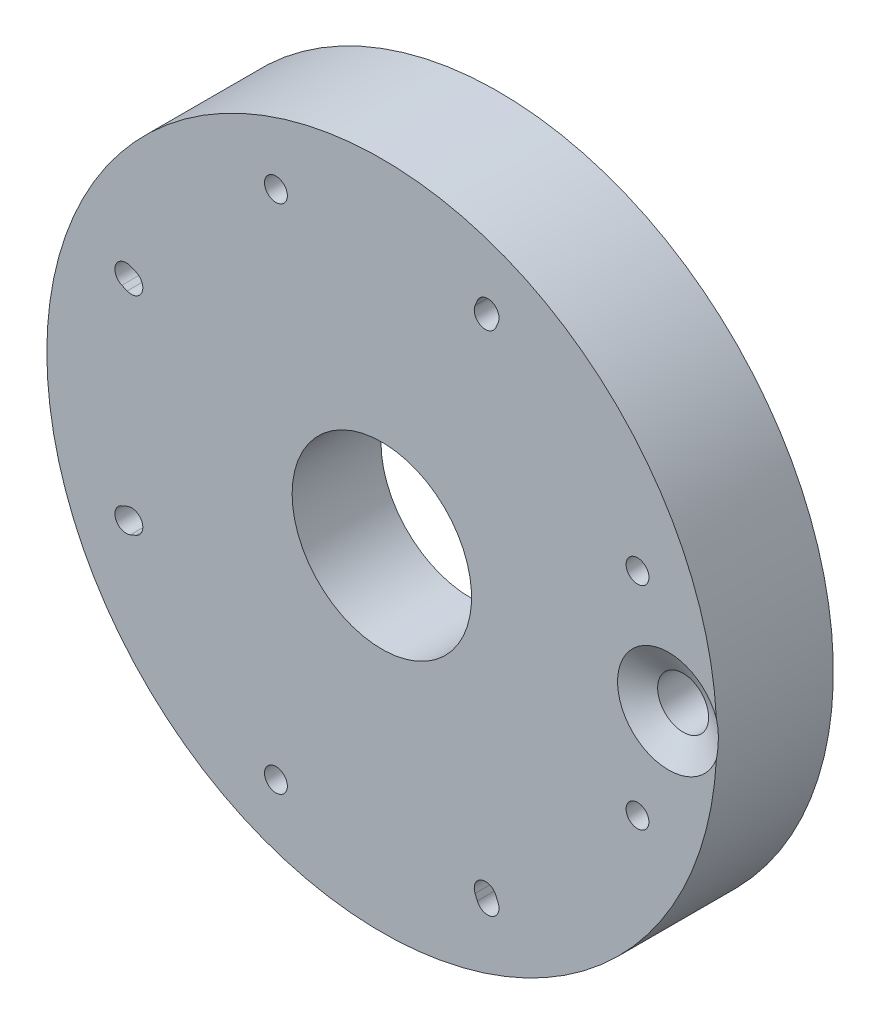
from build123d import *

# Parameters (mm, degrees)
CUT_EXTRUDE1_START               = 4.2164
SKETCH18_R                       = 57.15
CUT_EXTRUDE1_DEPTH               = 4.2164
F_10_CLEARANCE_HOLE1_D           = 4.9784
CIRPATTERN1_COUNT                = 8
CLEARANCING_START                = -4.2164
SKETCH32_R                       = 73.025
CLEARANCING_DEPTH                = 4.2164
F_10_START                       = 4.2164
F_10_0_1935_DIAMETER_SLOT1_DEPTH = 25.4
CIRPATTERN2_COUNT                = 8


# Read off the part's stored shape, not the designer's step: #10 (0.1935) Diameter Slot1
with BuildPart() as part:
    # Sketch25 → Revolve1 (revolve)
    with BuildSketch(Plane(origin=(0, 0, 0), x_dir=(1, 0, 0), z_dir=(0, 1, 0))):
        Polygon((-19.558, -29.6164), (-19.558, -10.24382), (-39.2684, -10.24382), (-39.2684, 0), (-57.15, 0), (-57.15, -4.2164), (-73.025, -4.2164), (-73.025, -29.6164), align=None)
    revolve(axis=Axis((0, 0, -8.4836), (0, 0, 1)))

    # Sketch18 → Cut-Extrude1 (cut)
    with BuildSketch(Plane.XY.offset(CUT_EXTRUDE1_START)):
        Circle(SKETCH18_R)
        with BuildLine():
            add(Edge.make_bspline(
                [(41.089237213, 0), (41.091962531, -0.086157587), (41.097413749, -0.258491166), (41.10355964, -0.517077072), (41.10820678, -0.775748178), (41.11421023, -1.293415642), (41.109015311, -2.589274196), (41.017814103, -4.490313926), (40.7831208, -6.729807087), (40.462314107, -8.787506492), (40.037808727, -10.829994254), (39.510298345, -12.852043551), (38.880746853, -14.848458078), (38.15038378, -16.814086746), (37.320701547, -18.743836999), (36.393451781, -20.63268838), (35.370641466, -22.475705706), (34.254528452, -24.268052099), (33.047616433, -26.005001751), (31.752649319, -27.681952446), (30.372605018, -29.294437787), (28.910688618, -30.83813911), (27.370324987, -32.308897058), (25.755150794, -33.702722776), (24.069005972, -35.015808715), (22.315924639, -36.244539), (20.500125495, -37.385499343), (18.62600172, -38.435486481), (16.698110388, -39.3915171), (14.721161433, -40.250836227), (12.700006186, -41.010925075), (10.639625512, -41.669508306), (8.545117571, -42.224560694), (6.421685244, -42.674313186), (4.274623243, -43.017258312), (2.109304944, -43.252154961), (-0.068831028, -43.378032487), (-2.254294428, -43.394194133), (-4.441557201, -43.300219785), (-6.625067428, -43.095968006), (-8.799263397, -42.781577389), (-10.958587737, -42.35746718), (-13.097501591, -41.8243372), (-15.210498799, -41.183167044), (-17.292120038, -40.435214565), (-19.336966901, -39.582013644), (-21.339715858, -38.62537124), (-23.295132091, -37.567363743), (-25.198083132, -36.410332623), (-27.043552306, -35.156879378), (-28.826651909, -33.809859817), (-30.542636113, -32.372377659), (-32.186913551, -30.847777489), (-33.75505955, -29.239637062), (-35.242827981, -27.551758997), (-36.6461627, -25.788161864), (-37.961208531, -23.953070684), (-39.184321792, -22.050906876), (-40.312080298, -20.086277666), (-41.34129285, -18.063964982), (-42.269008156, -15.988913871), (-43.092523175, -13.866220454), (-43.809390856, -11.701119456), (-44.417427247, -9.498971339), (-44.914717965, -7.265249075), (-45.299623986, -5.005524575), (-45.570786769, -2.725454833), (-45.727132667, -0.430767795), (-45.767876634, 1.872751999), (-45.692525205, 4.179277959), (-45.500878745, 6.482956161), (-45.193032951, 8.777920163), (-44.76937961, 11.058305925), (-44.2306066, 13.318266753), (-43.577697135, 15.551988265), (-42.811928261, 17.753703317), (-41.934868588, 19.917706858), (-40.948375273, 22.038370685), (-39.854590259, 24.110158043), (-38.655935769, 26.127638043), (-37.35510908, 28.085499861), (-35.95507656, 29.978566677), (-34.45906702, 31.801809315), (-32.870564351, 33.550359561), (-31.193299507, 35.2195231), (-29.431241811, 36.804792072), (-27.58858964, 38.301857174), (-25.669760482, 39.706619311), (-23.67938041, 41.015200739), (-21.62227298, 42.22395569), (-19.503447594, 43.329480427), (-17.328087349, 44.32862273), (-15.101536401, 45.218490759), (-12.829286876, 45.996461288), (-10.51696536, 46.660187279), (-8.170319005, 47.207604779), (-5.795201275, 47.63693911), (-3.397557376, 47.946710349), (-0.983409407, 48.13573807), (1.441158736, 48.203145338), (3.870016668, 48.148361942), (6.297002983, 47.971126851), (8.715940862, 47.671489899), (11.120653763, 47.249812672), (13.504981164, 46.706768607), (15.862794321, 46.043342297), (18.188011992, 45.260827993), (20.47461609, 44.360827321), (22.71666723, 43.345246195), (24.908320125, 42.216290953), (27.043838787, 40.976463712), (29.117611505, 39.628556947), (31.12416555, 38.175647316), (33.058181574, 36.621088743), (34.914507669, 34.968504765), (36.688173034, 33.221780166), (38.374401232, 31.385051924), (39.968622994, 29.462699478), (41.466488529, 27.459334348), (42.863879321, 25.37978913), (44.156919368, 23.229105887), (45.341985843, 21.012523976), (46.415719137, 18.735467323), (47.152873419, 16.943563677), (47.537044371, 15.914838228), (47.625380995, 15.672606956)],
                knots=[0, 0, 0, 0, 0.000898736, 0.001797664, 0.002696784, 0.003596095, 0.007195255, 0.016206602, 0.023429565, 0.030664921, 0.03791271, 0.04517297, 0.052445735, 0.059731037, 0.067028905, 0.074339368, 0.081662453, 0.088998186, 0.096346593, 0.103707696, 0.111081519, 0.118468084, 0.125867414, 0.13327953, 0.140704451, 0.148142199, 0.155592793, 0.163056252, 0.170532595, 0.178021841, 0.185524007, 0.193039111, 0.200567171, 0.208108204, 0.215662226, 0.223229255, 0.230809306, 0.238402396, 0.24600854, 0.253627754, 0.261260054, 0.268905454, 0.27656397, 0.284235617, 0.291920409, 0.29961836, 0.307329485, 0.315053798, 0.322791313, 0.330542044, 0.338306004, 0.346083208, 0.353873668, 0.361677398, 0.369494411, 0.37732472, 0.385168337, 0.393025277, 0.400895551, 0.408779172, 0.416676152, 0.424586504, 0.432510241, 0.440447374, 0.448397915, 0.456361877, 0.464339271, 0.472330109, 0.480334403, 0.488352164, 0.496383405, 0.504428136, 0.512486369, 0.520558115, 0.528643386, 0.536742193, 0.544854546, 0.552980457, 0.561119937, 0.569272997, 0.577439648, 0.585619899, 0.593813763, 0.60202125, 0.61024237, 0.618477134, 0.626725552, 0.634987634, 0.643263392, 0.651552835, 0.659855974, 0.668172818, 0.676503379, 0.684847665, 0.693205688, 0.701577457, 0.709962981, 0.718362272, 0.726775338, 0.73520219, 0.743642837, 0.752097289, 0.760565555, 0.769047646, 0.777543571, 0.786053339, 0.79457696, 0.803114443, 0.811665798, 0.820231034, 0.828810161, 0.837403187, 0.846010122, 0.854630975, 0.863265756, 0.871914473, 0.880577136, 0.889253753, 0.897944334, 0.906648887, 0.915367423, 0.924099948, 0.932846474, 0.941607007, 0.944295232, 0.944295232, 0.944295232, 0.944295232], degree=3))
            ThreePointArc((47.625380995, 15.672606956), (47.687720846, 10.629001226), (44.585991464, 6.651424093))
            ThreePointArc((44.585991464, 6.651424093), (41.960682048, 3.786728615), (41.089237213, 0))
        make_face(mode=Mode.SUBTRACT)
    extrude(amount=-CUT_EXTRUDE1_DEPTH, mode=Mode.SUBTRACT)

    # Sketch20 one side → Turbine Shaft Hole (revolve, cut)
    with BuildSketch(Plane(origin=(0, 0, 0), x_dir=(1, 0, 0), z_dir=(0, 1, 0)), mode=Mode.PRIVATE) as turbine_shaft_hole_sk:
        Polygon((56.94375, -26.4414), (51.3875, -29.6164), (62.5, -29.6164), (62.5, -4.2164), (56.94375, -4.2164), align=None)
    revolve(turbine_shaft_hole_sk.sketch.rotate(Axis((62.5, 0, 29.6164), (0, 0, -1)), 180), axis=Axis((62.5, 0, 29.6164), (0, 0, -1)), mode=Mode.SUBTRACT)

    # #10 Clearance Hole1 (through all)
    with Locations(Plane(origin=(55.733032799, -23.085378057, 29.6164), x_dir=(1, 0, 0), z_dir=(0, 0, 1))):
        with Locations((0, 0)):
            f_10_clearance_hole1 = Hole(F_10_CLEARANCE_HOLE1_D / 2)

    # CirPattern1: #10 Clearance Hole1 ×8 about axis, 4 skipped
    cirpattern1_axis = Axis((0, 0, 0), (0, 0, 1))
    add([f_10_clearance_hole1.rotate(cirpattern1_axis, i * 360 / CIRPATTERN1_COUNT) for i in range(1, CIRPATTERN1_COUNT) if i not in (2, 4, 5, 7)], mode=Mode.SUBTRACT)

    # Sketch32 → Clearancing (cut)
    with BuildSketch(Plane(origin=(0, 0, 0), x_dir=(-1, 0, 0), z_dir=(0, 0, -1)).offset(CLEARANCING_START)):
        Circle(SKETCH32_R)
        with BuildLine():
            ThreePointArc((-47.506067229, 15.629095748), (-47.567368082, 10.669550114), (-44.51733419, 6.758265932))
            ThreePointArc((-44.51733419, 6.758265932), (-41.848269617, 3.845825531), (-40.962300701, -0.004015228))
            add(Edge.make_bspline(
                [(-40.962300701, -0.004015228), (-40.984829754, -0.716243545), (-40.991482345, -1.426292399), (-40.965808515, -2.841039211), (-40.934791994, -3.545916987), (-40.788046598, -5.65317915), (-40.449416827, -8.44323574), (-39.826992242, -11.194334019), (-39.251228801, -13.242702158), (-39.04041264, -13.924921757), (-38.586043887, -15.271416492), (-38.342460818, -15.936244836), (-37.044241995, -19.219159068), (-35.751111298, -21.714802599), (-33.817948717, -24.671739224), (-33.415325439, -25.254916955), (-32.577512865, -26.404553153), (-32.142989691, -26.969901223), (-30.805310798, -28.622109954), (-29.863742521, -29.67138319), (-27.88370287, -31.668321975), (-26.84522274, -32.615978344), (-25.214580249, -33.961000268), (-24.658855428, -34.396572383), (-23.52273746, -35.241850655), (-22.941371199, -35.652200602), (-19.982337143, -37.630798215), (-17.495723306, -38.952149767), (-13.594391809, -40.558687212), (-12.265158452, -41.031133778), (-10.227142901, -41.643055288), (-9.538560062, -41.831284287), (-8.159344959, -42.171675018), (-7.468051402, -42.324142065), (-4.003321953, -42.999606071), (-1.205332292, -43.264420661), (2.324696242, -43.253266134), (3.032343885, -43.233770306), (4.450976737, -43.159684207), (5.16260658, -43.104918353), (7.279359647, -42.889714494), (8.673993393, -42.678265993), (12.809724164, -41.845880015), (15.503095197, -41.028729387), (18.787939685, -39.670706521), (19.439945622, -39.382349429), (20.721782261, -38.777972555), (21.353348612, -38.461258619), (23.220466367, -37.468277477), (25.636538884, -36.03026989), (27.907728904, -34.367230475), (29.556019298, -33.034366172), (30.096251631, -32.575792031), (31.157992098, -31.629561277), (31.678275818, -31.142874487), (34.206194586, -28.662350465), (36.015531715, -26.510793678), (38.41831625, -23.039245987), (39.16701973, -21.841083162), (40.20957198, -19.98066895), (40.543029676, -19.350876534), (41.176251076, -18.083381709), (41.476896624, -17.444132119), (42.901648241, -14.220838418), (43.792349276, -11.556354365), (44.594692676, -8.118555948), (44.739484647, -7.425593495), (44.997193357, -6.028683216), (45.110048425, -5.324423569), (45.397284161, -3.217220036), (45.521950193, -1.812522973), (45.701086012, 2.401261181), (45.562340657, 5.210043831), (45.059447785, 8.720503026), (44.941902272, 9.424175437), (44.675570213, 10.818485677), (44.526710242, 11.510176401), (44.03392467, 13.569160455), (43.253850892, 16.271636591), (42.232110927, 18.889968175), (41.374523909, 20.821933821), (41.073427004, 21.460617921), (40.440358133, 22.727235888), (40.107694699, 23.35639756), (38.373818129, 26.460390162), (36.780750271, 28.78088885), (34.095328382, 32.027965174), (33.150564893, 33.07112628), (31.657831232, 34.576159768), (31.147637834, 35.06787246), (30.101580295, 36.031020228), (29.567134533, 36.501054535), (26.856787595, 38.778313639), (24.550582917, 40.384325472), (20.890041552, 42.47849974), (19.636115903, 43.123761403), (17.703471684, 44.01067886), (17.048967242, 44.293434078), (15.733188711, 44.827093949), (15.071549163, 45.078271992), (11.744943292, 46.257335392), (9.025190072, 46.956566279), (4.859147554, 47.644767103), (3.455979938, 47.813706456), (1.328883106, 47.973856364), (0.6186853, 48.011419961), (-0.796199225, 48.054972454), (-1.502092621, 48.06105803), (-5.023934167, 48.014237149), (-7.817182412, 47.731371248), (-11.278596108, 47.072391218), (-11.96936046, 46.925213328), (-13.347812594, 46.599690607), (-14.03708102, 46.420880282), (-16.087853103, 45.84036778), (-17.428630402, 45.396086399), (-21.374271765, 43.89689302), (-23.903005899, 42.67684778), (-26.936352555, 40.875077272), (-27.536597899, 40.500788916), (-28.724048455, 39.723926887), (-29.311972723, 39.320747942), (-31.039486686, 38.080104884), (-32.148213344, 37.208324215), (-35.349169758, 34.462697204), (-37.317082683, 32.459509238), (-39.567440801, 29.737522075), (-40.006964214, 29.18215008), (-40.86456786, 28.049096194), (-41.281778161, 27.472452922), (-42.490525828, 25.724130807), (-43.242666913, 24.529670436), (-45.341238448, 20.861286589), (-46.530959758, 18.302975659), (-47.506067229, 15.629095748)],
                knots=[0, 0, 0, 0, 0.0078125, 0.0078125, 0.015625, 0.015625, 0.03125, 0.046875, 0.046875, 0.0546875, 0.0546875, 0.0625, 0.0625, 0.09375, 0.09375, 0.1015625, 0.1015625, 0.109375, 0.109375, 0.125, 0.125, 0.140625, 0.140625, 0.1484375, 0.1484375, 0.15625, 0.15625, 0.1875, 0.1875, 0.203125, 0.203125, 0.2109375, 0.2109375, 0.21875, 0.21875, 0.25, 0.25, 0.2578125, 0.2578125, 0.265625, 0.265625, 0.28125, 0.28125, 0.3125, 0.3125, 0.3203125, 0.3203125, 0.328125, 0.328125, 0.34375, 0.359375, 0.359375, 0.3671875, 0.3671875, 0.375, 0.375, 0.40625, 0.40625, 0.421875, 0.421875, 0.4296875, 0.4296875, 0.4375, 0.4375, 0.46875, 0.46875, 0.4765625, 0.4765625, 0.484375, 0.484375, 0.5, 0.5, 0.53125, 0.53125, 0.5390625, 0.5390625, 0.546875, 0.546875, 0.5625, 0.578125, 0.578125, 0.5859375, 0.5859375, 0.59375, 0.59375, 0.625, 0.625, 0.640625, 0.640625, 0.6484375, 0.6484375, 0.65625, 0.65625, 0.6875, 0.6875, 0.703125, 0.703125, 0.7109375, 0.7109375, 0.71875, 0.71875, 0.75, 0.75, 0.765625, 0.765625, 0.7734375, 0.7734375, 0.78125, 0.78125, 0.8125, 0.8125, 0.8203125, 0.8203125, 0.828125, 0.828125, 0.84375, 0.84375, 0.875, 0.875, 0.8828125, 0.8828125, 0.890625, 0.890625, 0.90625, 0.90625, 0.9375, 0.9375, 0.9453125, 0.9453125, 0.953125, 0.953125, 0.96875, 0.96875, 1, 1, 1, 1], degree=3))
        make_face(mode=Mode.SUBTRACT)
    extrude(amount=CLEARANCING_DEPTH, mode=Mode.SUBTRACT)

    # #10 (0.1935) Diameter Slot1 outline → #10 (0.1935) Diameter Slot1 (cut)
    with BuildSketch(Plane.XY.offset(F_10_START)):
        with BuildLine():
            ThreePointArc((20.8149903, -56.6734582), (24.025803458, -58.003420556), (25.355765815, -54.792607398))
            Line((25.355765815, -54.792607398), (24.869757855, -53.619280392))
            ThreePointArc((24.869757855, -53.619280392), (21.658944697, -52.289318035), (20.328982341, -55.500131193))
            Line((20.328982341, -55.500131193), (20.8149903, -56.6734582))
        make_face()
    f_10_0_1935_diameter_slot1 = extrude(amount=F_10_0_1935_DIAMETER_SLOT1_DEPTH, mode=Mode.SUBTRACT)

    # CirPattern2: #10 (0.1935) Diameter Slot1 ×8 about axis, 4 skipped
    cirpattern2_axis = Axis((0, 0, -50.361336866), (0, 0, 1))
    add([f_10_0_1935_diameter_slot1.rotate(cirpattern2_axis, i * 360 / CIRPATTERN2_COUNT) for i in range(1, CIRPATTERN2_COUNT) if i not in (1, 2, 4, 7)], mode=Mode.SUBTRACT)


solid = part.part
